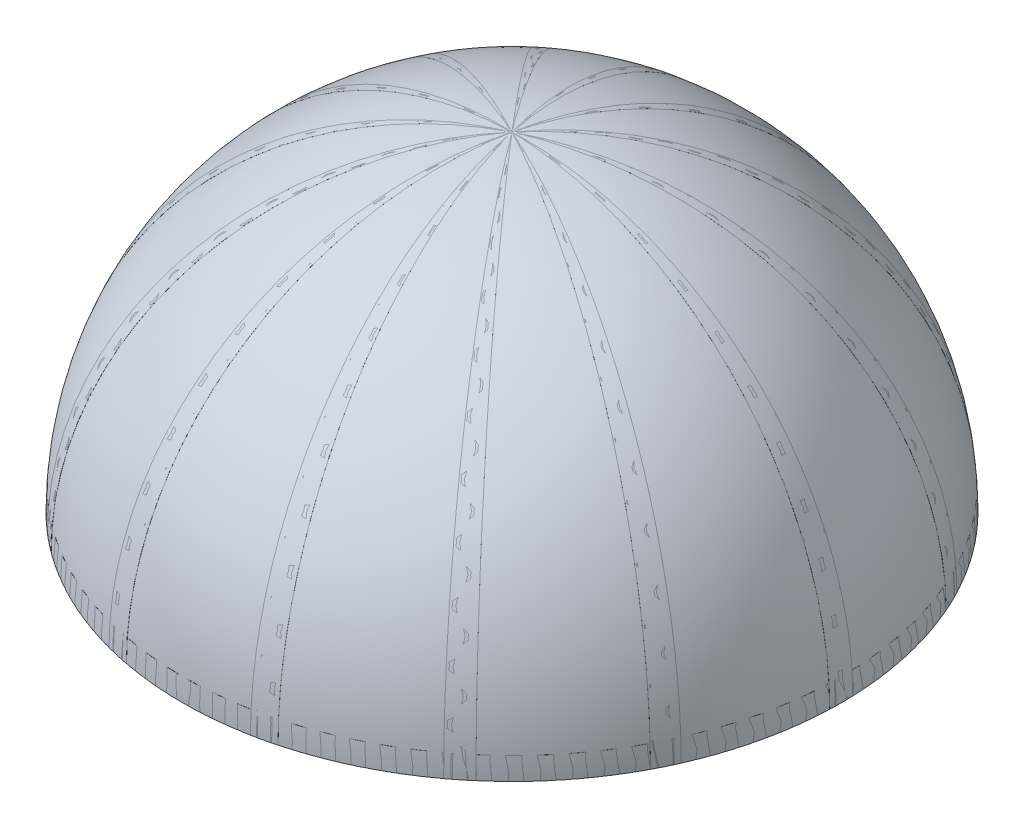
from build123d import *
from build123d.topology import SkipClean

# Parameters (mm, degrees)
SHELL_ANGLE              = 180
REVOLVE1_ANGLE           = 2
REVOLVE1_OTHER_WAY_ANGLE = 2
CIRPATTERN1_COUNT        = 14


with BuildPart() as part:
    # Sketch9 → Shell (revolve)
    with BuildSketch(Plane(origin=(0, 0, 0), x_dir=(1, 0, 0), z_dir=(0, 1, 0))):
        with BuildLine():
            Line((0, 75), (0, 71))
            ThreePointArc((0, 71), (-71, 0), (0, -71))
            Line((0, -71), (0, -75))
            ThreePointArc((0, -75), (-75, 0), (0, 75))
        make_face()
    revolve(axis=Axis((0, 0, -75), (0, 0, -1)), revolution_arc=SHELL_ANGLE)


with BuildPart() as body_2:
    # Sketch4 → Base (revolve)
    with BuildSketch(Plane.XY, mode=Mode.PRIVATE) as base_sk:
        with BuildLine():
            Line((-75, 0), (-71, 0))
            ThreePointArc((-71, 0), (-70.955918, 2.501553), (-70.823725, 5))
            Line((-70.823725, 5), (-74.833148, 5))
            ThreePointArc((-74.833148, 5), (-74.958275, 2.501392), (-75, 0))
        make_face()
    revolve(base_sk.sketch.rotate(Axis((0, 0, 0), (0, 1, 0)), 90), axis=Axis((0, 0, 0), (0, 1, 0)))


with BuildPart() as body_3:
    # Sketch10 → Revolve1 (revolve)
    with BuildSketch(Plane.XY):
        with BuildLine():
            Line((-75, 0), (-71, 0))
            ThreePointArc((-71, 0), (-50.204581, 50.204581), (0, 71))
            Line((0, 71), (0, 75))
            ThreePointArc((0, 75), (-53.033009, 53.033009), (-75, 0))
        make_face()
    revolve(axis=Axis((0, 77.348181, 0), (0, 1, 0)), revolution_arc=REVOLVE1_ANGLE)

    # Sketch10 → Revolve1 other way (revolve)
    with SkipClean():  # the faces are left unmerged after this step: merging them gives an invalid solid
        with BuildSketch(Plane.XY):
            with BuildLine():
                Line((-75, 0), (-71, 0))
                ThreePointArc((-71, 0), (-50.204581, 50.204581), (0, 71))
                Line((0, 71), (0, 75))
                ThreePointArc((0, 75), (-53.033009, 53.033009), (-75, 0))
            make_face()
        revolve(axis=Axis((0, 77.348181, 0), (0, -1, 0)), revolution_arc=REVOLVE1_OTHER_WAY_ANGLE)


with BuildPart() as cirpattern1_1:
    # CirPattern1: pattern copy
    add(body_3.part.rotate(Axis((0, 0, 0), (0, 1, 0)), 1 * 360 / CIRPATTERN1_COUNT))


with BuildPart() as cirpattern1_2:
    # CirPattern1: pattern copy
    add(body_3.part.rotate(Axis((0, 0, 0), (0, 1, 0)), 2 * 360 / CIRPATTERN1_COUNT))


with BuildPart() as cirpattern1_3:
    # CirPattern1: pattern copy
    add(body_3.part.rotate(Axis((0, 0, 0), (0, 1, 0)), 3 * 360 / CIRPATTERN1_COUNT))


with BuildPart() as cirpattern1_4:
    # CirPattern1: pattern copy
    add(body_3.part.rotate(Axis((0, 0, 0), (0, 1, 0)), 4 * 360 / CIRPATTERN1_COUNT))


with BuildPart() as cirpattern1_5:
    # CirPattern1: pattern copy
    add(body_3.part.rotate(Axis((0, 0, 0), (0, 1, 0)), 5 * 360 / CIRPATTERN1_COUNT))


with BuildPart() as cirpattern1_6:
    # CirPattern1: pattern copy
    add(body_3.part.rotate(Axis((0, 0, 0), (0, 1, 0)), 6 * 360 / CIRPATTERN1_COUNT))


with BuildPart() as cirpattern1_7:
    # CirPattern1: pattern copy
    add(body_3.part.rotate(Axis((0, 0, 0), (0, 1, 0)), 7 * 360 / CIRPATTERN1_COUNT))


with BuildPart() as cirpattern1_8:
    # CirPattern1: pattern copy
    add(body_3.part.rotate(Axis((0, 0, 0), (0, 1, 0)), 8 * 360 / CIRPATTERN1_COUNT))


with BuildPart() as cirpattern1_9:
    # CirPattern1: pattern copy
    add(body_3.part.rotate(Axis((0, 0, 0), (0, 1, 0)), 9 * 360 / CIRPATTERN1_COUNT))


with BuildPart() as cirpattern1_10:
    # CirPattern1: pattern copy
    add(body_3.part.rotate(Axis((0, 0, 0), (0, 1, 0)), 10 * 360 / CIRPATTERN1_COUNT))


with BuildPart() as cirpattern1_11:
    # CirPattern1: pattern copy
    add(body_3.part.rotate(Axis((0, 0, 0), (0, 1, 0)), 11 * 360 / CIRPATTERN1_COUNT))


with BuildPart() as cirpattern1_12:
    # CirPattern1: pattern copy
    add(body_3.part.rotate(Axis((0, 0, 0), (0, 1, 0)), 12 * 360 / CIRPATTERN1_COUNT))


with BuildPart() as cirpattern1_13:
    # CirPattern1: pattern copy
    add(body_3.part.rotate(Axis((0, 0, 0), (0, 1, 0)), 13 * 360 / CIRPATTERN1_COUNT))


solid = Compound([part.part, body_2.part, body_3.part, cirpattern1_1.part, cirpattern1_2.part, cirpattern1_3.part, cirpattern1_4.part, cirpattern1_5.part, cirpattern1_6.part, cirpattern1_7.part, cirpattern1_8.part, cirpattern1_9.part, cirpattern1_10.part, cirpattern1_11.part, cirpattern1_12.part, cirpattern1_13.part])
